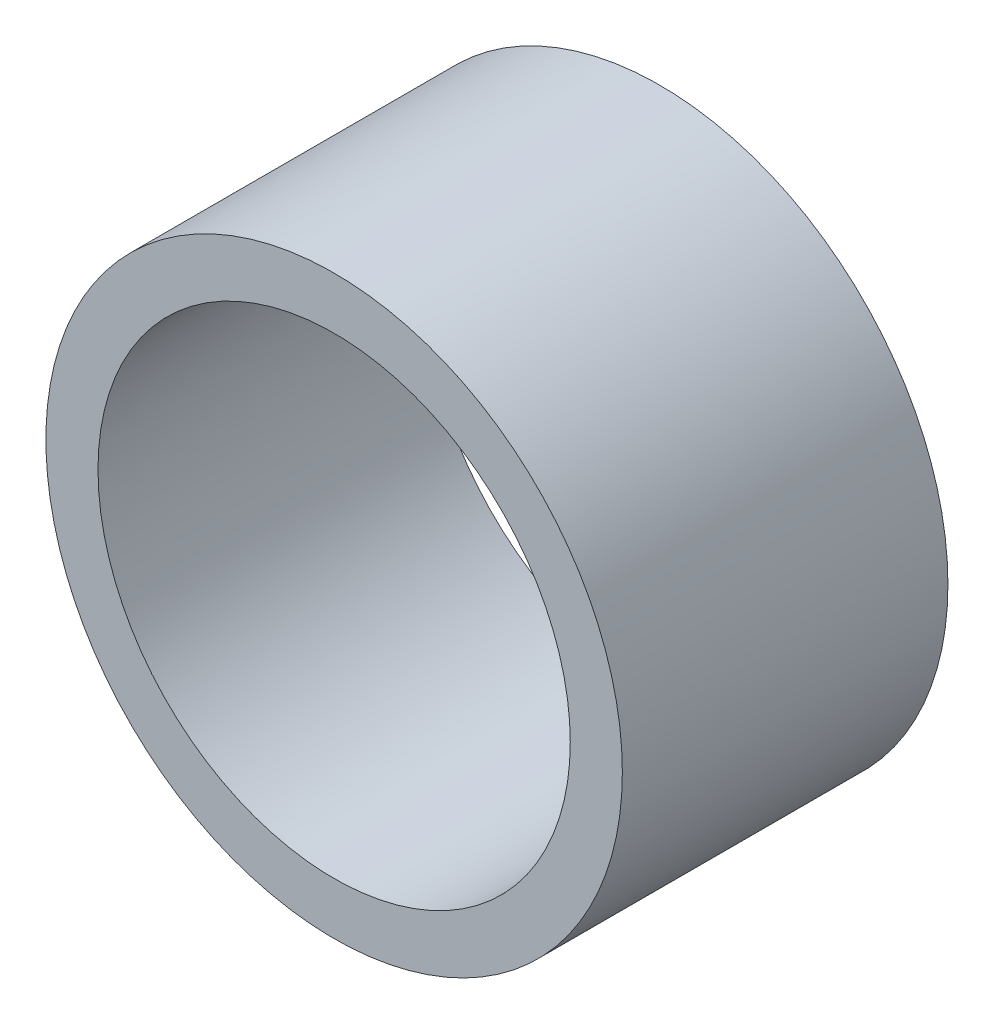
from build123d import *

# Parameters (mm, degrees)
SKETCH2_R           = 21.082
SKETCH2_R_2         = 17.272
BOSS_EXTRUDE1_DEPTH = 23.8125


with BuildPart() as part:
    # Sketch2 → Boss-Extrude1 (new body)
    with BuildSketch(Plane.XY):
        Circle(SKETCH2_R)
        Circle(SKETCH2_R_2, mode=Mode.SUBTRACT)
    extrude(amount=BOSS_EXTRUDE1_DEPTH)


solid = part.part
